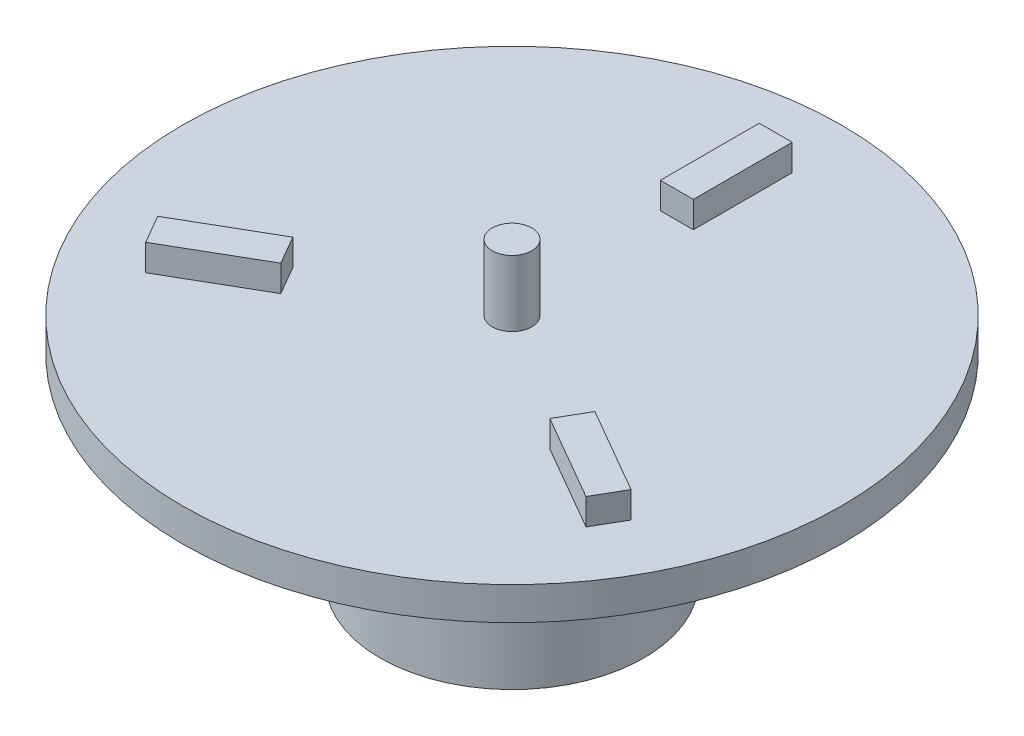
from build123d import *

# Parameters (mm, degrees)
ESQUISSE1_R                  = 4
BOSS_EXTRU_1_DEPTH           = 5
ESQUISSE4_R                  = 5.5
BOSS_EXTRU_3_DEPTH           = 1
ESQUISSE5_R                  = 10
BOSS_EXTRU_4_DEPTH           = 1
ESQUISSE6_R                  = 0.6
BOSS_EXTRU_5_DEPTH           = 2
BOSS_EXTRU_6_DEPTH           = 0.8
R_P_TITION_CIRCULAIRE1_COUNT = 3


with BuildPart() as part:
    # Esquisse1 → Boss.-Extru.1 (new body)
    with BuildSketch(Plane(origin=(0, 0, 0), x_dir=(1, 0, 0), z_dir=(0, 1, 0))):
        Circle(ESQUISSE1_R)
    extrude(amount=BOSS_EXTRU_1_DEPTH)

    # Esquisse4 → Boss.-Extru.3 (add)
    with BuildSketch(Plane(origin=(0, 5, 0), x_dir=(1, 0, 0), z_dir=(0, 1, 0))):
        Circle(ESQUISSE4_R)
    extrude(amount=BOSS_EXTRU_3_DEPTH)

    # Esquisse5 → Boss.-Extru.4 (add)
    with BuildSketch(Plane(origin=(0, 6, 0), x_dir=(1, 0, 0), z_dir=(0, 1, 0))):
        Circle(ESQUISSE5_R)
    extrude(amount=BOSS_EXTRU_4_DEPTH)

    # Esquisse6 → Boss.-Extru.5 (add)
    with BuildSketch(Plane(origin=(0, 7, 0), x_dir=(1, 0, 0), z_dir=(0, 1, 0))):
        Circle(ESQUISSE6_R)
    extrude(amount=BOSS_EXTRU_5_DEPTH)

    # Esquisse7 → Boss.-Extru.6 (add)
    with BuildSketch(Plane(origin=(0, 7, 0), x_dir=(1, 0, 0), z_dir=(0, 1, 0))):
        Polygon((0, 5), (0.5, 5), (0.5, 8), (-0.5, 8), (-0.5, 5), align=None)
    boss_extru_6 = extrude(amount=BOSS_EXTRU_6_DEPTH)

    # Répétition circulaire1: Boss.-Extru.6 ×3 about axis
    r_p_tition_circulaire1_axis = Axis((0, 7, 0), (0, 1, 0))
    for i in range(1, R_P_TITION_CIRCULAIRE1_COUNT):
        add(boss_extru_6.rotate(r_p_tition_circulaire1_axis, i * 360 / R_P_TITION_CIRCULAIRE1_COUNT))


solid = part.part
